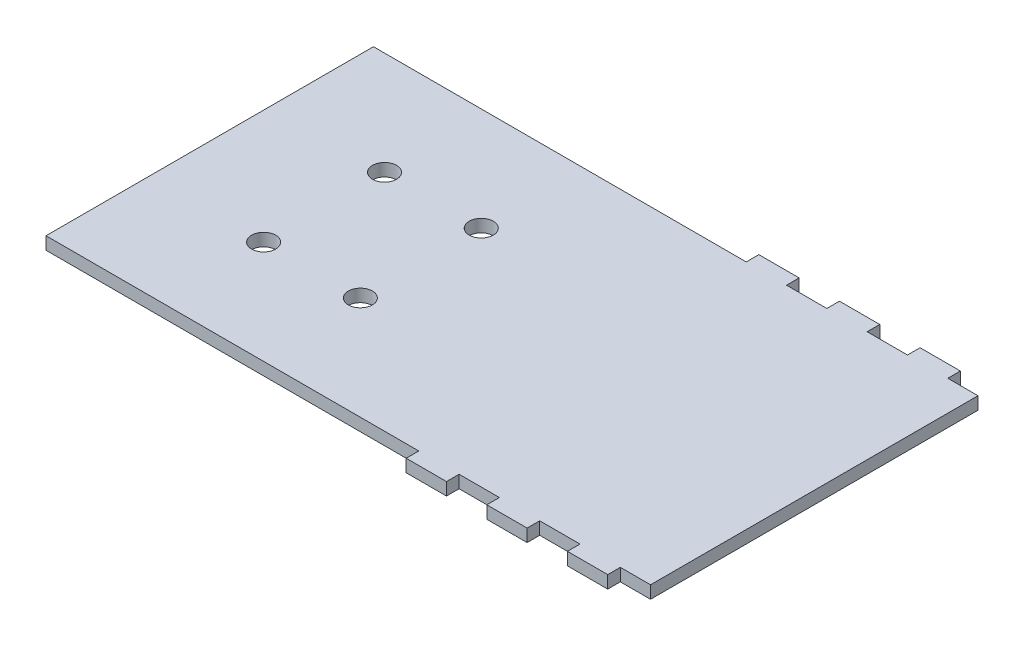
from build123d import *

# Parameters (mm, degrees)
BOSS_EXTRUDE1_DEPTH         = 3.175
SKETCH2_R                   = 3.039013601
CASTER_MOUNTING_HOLES_DEPTH = 89.274136218


with BuildPart() as part:
    # Sketch1 → Boss-Extrude1 (new body)
    with BuildSketch(Plane(origin=(0, 0, 0), x_dir=(1, 0, 0), z_dir=(0, 1, 0))):
        Polygon((27.94, -41.275), (38.1, -41.275), (38.1, -44.45), (48.26, -44.45), (48.26, -41.275), (58.42, -41.275), (58.42, -44.45), (68.58, -44.45), (68.58, -41.275), (76.2, -41.275), (76.2, 41.275), (68.58, 41.275), (68.58, 44.45), (58.42, 44.45), (58.42, 41.275), (48.26, 41.275), (48.26, 44.45), (38.1, 44.45), (38.1, 41.275), (27.94, 41.275), (27.94, 44.45), (17.78, 44.45), (17.78, 41.275), (-76.2, 41.275), (-76.2, -41.275), (17.78, -41.275), (17.78, -44.45), (27.94, -44.45), align=None)
    extrude(amount=BOSS_EXTRUDE1_DEPTH)

    # Sketch2 → Caster Mounting Holes (cut, through all)
    with BuildSketch(Plane(origin=(0, 3.175, 0), x_dir=(1, 0, 0), z_dir=(0, 1, 0))):
        with Locations((-47.3754273, 15.24)):
            Circle(SKETCH2_R)
        with Locations((-22.9914273, 15.24)):
            Circle(SKETCH2_R)
        with Locations((-22.9914273, -15.24)):
            Circle(SKETCH2_R)
        with Locations((-47.3754273, -15.24)):
            Circle(SKETCH2_R)
    extrude(amount=-CASTER_MOUNTING_HOLES_DEPTH, mode=Mode.SUBTRACT)


solid = part.part
